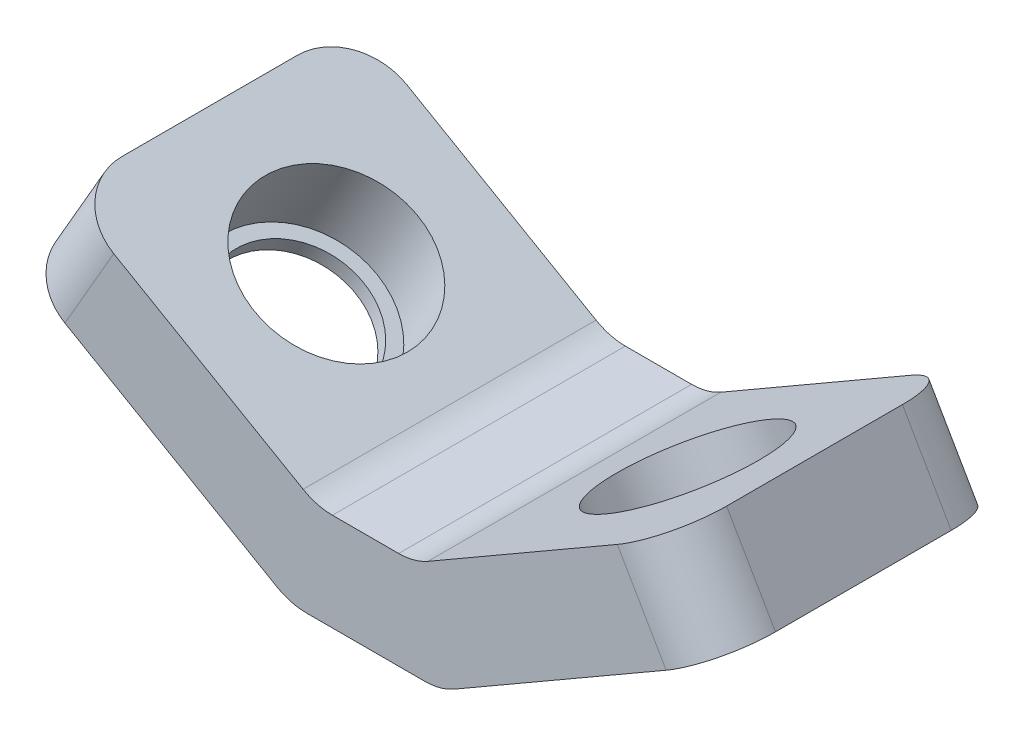
from build123d import *

# Parameters (mm, degrees)
EXTRUDE_1_DEPTH          = 7.5
CUT_EXTRUDE_1_DEPTH      = 27.249846584
CUT_EXTRUDE_1_DEPTH_BACK = 27.249846584
SKETCH_2_R               = 4.2
CUT_EXTRUDE_2_DEPTH      = 27.516200545
CUT_EXTRUDE_2_DEPTH_BACK = 27.516200545
SKETCH_3_R               = 4.2
FILLET_1_R               = 3
SKETCH_4_R               = 4.2
SKETCH_4_R_2             = 3.5
EXTRUDE_2_DEPTH          = 0.8
SKETCH_5_R               = 4.2
SKETCH_5_R_2             = 3.5
EXTRUDE_3_DEPTH          = 0.8


with BuildPart() as part:
    # ｽｹｯﾁ1 → ﾎﾞｽ - 押し出し1 (new, symmetric)
    with BuildSketch(Plane.XY):
        Polygon((0, 0), (-14.150635095, 8.169872981), (-11.650635095, 12.5), (1.339745962, 5), (6.339745962, 5), (19.330127019, 12.5), (21.830127019, 8.169872981), (7.679491924, 0), align=None)
    extrude(amount=EXTRUDE_1_DEPTH, both=True)

    # ｽｹｯﾁ2 → ｶｯﾄ - 押し出し1 (cut, two sides: drawn at the far end of the back side and taken through both)
    with BuildSketch(Plane(origin=(0, 0, 0), x_dir=(0, 0, 1), z_dir=(-0.5000000000000012, -0.866025403784438, 0)).offset(-CUT_EXTRUDE_1_DEPTH_BACK)):
        with Locations((0, 8.839745962)):
            Circle(SKETCH_2_R)
    extrude(amount=CUT_EXTRUDE_1_DEPTH + CUT_EXTRUDE_1_DEPTH_BACK, mode=Mode.SUBTRACT)

    # ｽｹｯﾁ3 → ｶｯﾄ - 押し出し2 (cut, two sides: drawn at the far end of the back side and taken through both)
    with BuildSketch(Plane(origin=(1.919872981, -3.325317547, 0), x_dir=(0, 0, -1), z_dir=(0.5000000000000013, -0.8660254037844379, 0)).offset(-CUT_EXTRUDE_2_DEPTH_BACK)):
        with Locations((0, 15.490381057)):
            Circle(SKETCH_3_R)
    extrude(amount=CUT_EXTRUDE_2_DEPTH + CUT_EXTRUDE_2_DEPTH_BACK, mode=Mode.SUBTRACT)

    # ﾌｨﾚｯﾄ1
    fillet_1_edges = [part.edges().sort_by_distance(p)[0] for p in [
        (20.580127019, 10.334936491, -7.5),
        (20.580127019, 10.334936491, 7.5),
        (-12.900635095, 10.334936491, -7.5),
        (-12.900635095, 10.334936491, 7.5),
        (7.679491924, 0, 0),
        (0, 0, 0),
        (6.339745962, 5, 0),
        (1.339745962, 5, 0),
    ]]
    fillet(fillet_1_edges, radius=FILLET_1_R)

    # ｽｹｯﾁ4 → ﾎﾞｽ - 押し出し2 (add)
    with BuildSketch(Plane(origin=(0, 0, 0), x_dir=(0.8660254037844382, -0.500000000000001, 0), z_dir=(0.5000000000000009, 0.866025403784438, 0))):
        with Locations((-8.839745962, 0)):
            Circle(SKETCH_4_R)
        with Locations((-8.839745962, 0)):
            Circle(SKETCH_4_R_2, mode=Mode.SUBTRACT)
    extrude(amount=EXTRUDE_2_DEPTH)

    # ｽｹｯﾁ5 → ﾎﾞｽ - 押し出し3 (add)
    with BuildSketch(Plane(origin=(1.919872981, -3.325317547, 0), x_dir=(0.8660254037844378, 0.5000000000000017, 0), z_dir=(-0.5000000000000016, 0.8660254037844377, 0))):
        with Locations((15.490381057, 0)):
            Circle(SKETCH_5_R)
        with Locations((15.490381057, 0)):
            Circle(SKETCH_5_R_2, mode=Mode.SUBTRACT)
    extrude(amount=EXTRUDE_3_DEPTH)


solid = part.part
